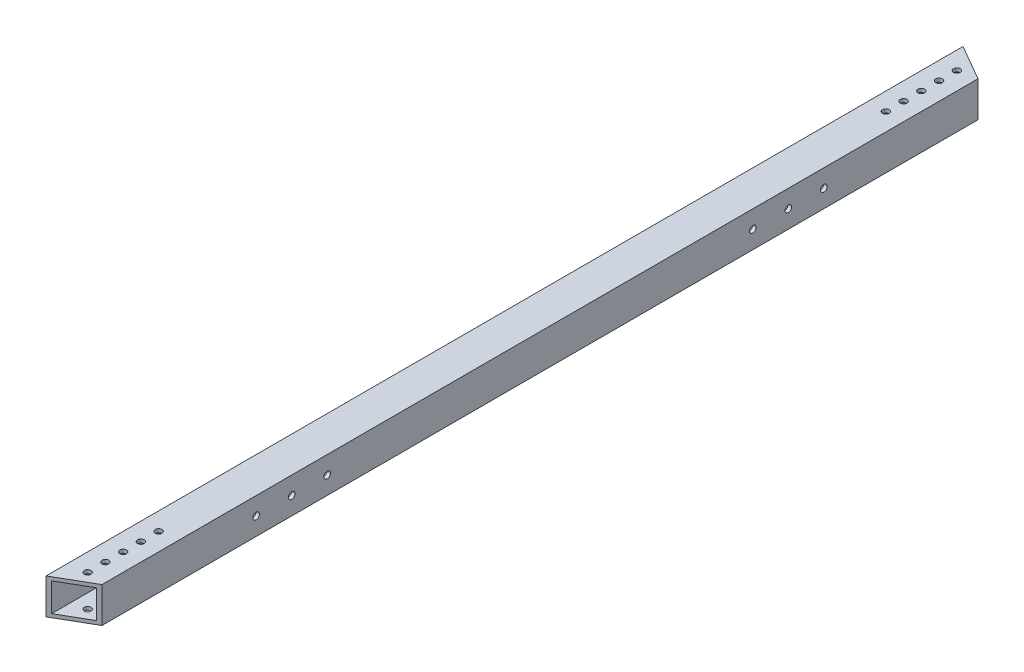
from build123d import *

# Parameters (mm, degrees)
SKETCH1_W           = 25.4
SKETCH1_H           = 25.4
SKETCH1_W_2         = 20.32
SKETCH1_H_2         = 20.32
BOSS_EXTRUDE2_DEPTH = 656.5743028
CUT_EXTRUDE1_DEPTH  = 658.188150454
SKETCH3_R           = 2.38125
CUT_EXTRUDE2_DEPTH  = 658.188150454
SKETCH4_R           = 2.38125
CUT_EXTRUDE3_DEPTH  = 658.188150454


with BuildPart() as part:
    # Sketch1 → Boss-Extrude2 (new body)
    with BuildSketch(Plane.XY):
        Rectangle(SKETCH1_W, SKETCH1_H)
        Rectangle(SKETCH1_W_2, SKETCH1_H_2, mode=Mode.SUBTRACT)
    extrude(amount=BOSS_EXTRUDE2_DEPTH)

    # Sketch2 → Cut-Extrude1 (cut, through all)
    with BuildSketch(Plane(origin=(0, 12.7, 0), x_dir=(1, 0, 0), z_dir=(0, 1, 0))):
        Polygon((-12.7, -656.5743028), (12.7, -641.909605963), (12.7, -656.5743028), align=None)
        Polygon((12.7, 0), (-12.7, 0), (12.7, -14.664696837), align=None)
    extrude(amount=-CUT_EXTRUDE1_DEPTH, mode=Mode.SUBTRACT)

    # Sketch3 → Cut-Extrude2 (cut, through all)
    with BuildSketch(Plane(origin=(0, 12.7, 0), x_dir=(1, 0, 0), z_dir=(0, 1, 0))):
        with Locations((0, -639.4371514)):
            Circle(SKETCH3_R)
        with Locations((0, -626.7371514)):
            Circle(SKETCH3_R)
        with Locations((0, -614.0371514)):
            Circle(SKETCH3_R)
        with Locations((0, -601.3371514)):
            Circle(SKETCH3_R)
        with Locations((0, -588.6371514)):
            Circle(SKETCH3_R)
        with Locations((0, -67.9371514)):
            Circle(SKETCH3_R)
        with Locations((0, -55.2371514)):
            Circle(SKETCH3_R)
        with Locations((0, -42.5371514)):
            Circle(SKETCH3_R)
        with Locations((0, -29.8371514)):
            Circle(SKETCH3_R)
        with Locations((0, -17.1371514)):
            Circle(SKETCH3_R)
    extrude(amount=-CUT_EXTRUDE2_DEPTH, mode=Mode.SUBTRACT)

    # Sketch4 → Cut-Extrude3 (cut, through all)
    with BuildSketch(Plane.ZY.offset(12.7)):
        with Locations((175.8871514, 0)):
            Circle(SKETCH4_R)
        with Locations((150.4871514, 0)):
            Circle(SKETCH4_R)
        with Locations((125.0871514, 0)):
            Circle(SKETCH4_R)
        with Locations((531.4871514, 0)):
            Circle(SKETCH4_R)
        with Locations((506.0871514, 0)):
            Circle(SKETCH4_R)
        with Locations((480.6871514, 0)):
            Circle(SKETCH4_R)
    extrude(amount=-CUT_EXTRUDE3_DEPTH, mode=Mode.SUBTRACT)


solid = part.part
